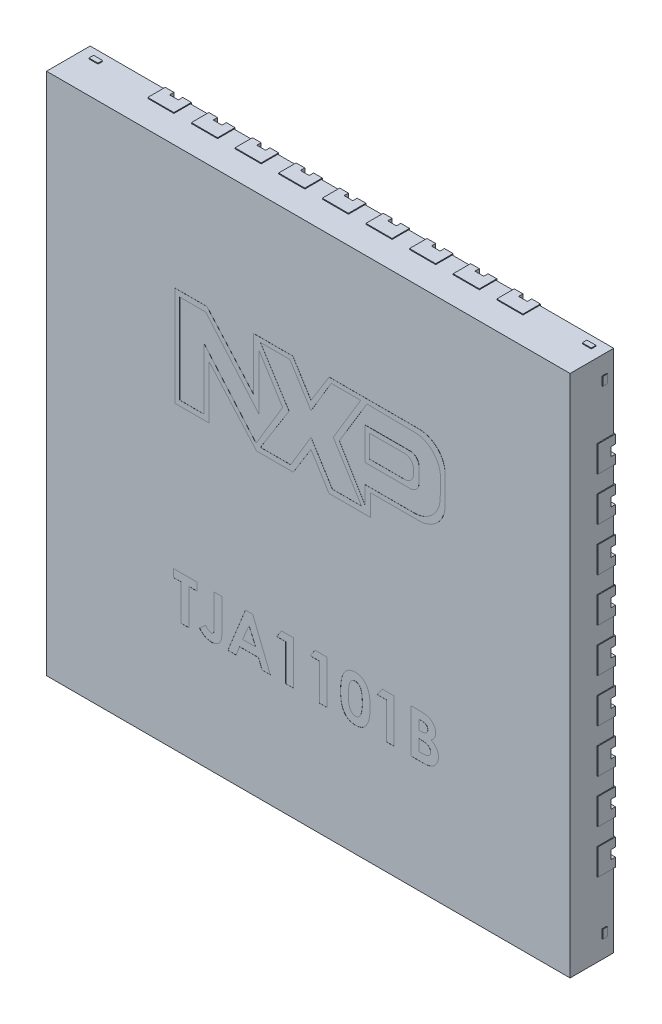
from build123d import *

# Parameters (mm, degrees)
SKETCH1_W           = 6
SKETCH1_H           = 6
BOSS_EXTRUDE1_DEPTH = 0.5
CUT_EXTRUDE2_DEPTH  = 0.001
BOSS_EXTRUDE2_DEPTH = 0.001
CUT_EXTRUDE3_DEPTH  = 0.001
BOSS_EXTRUDE3_DEPTH = 0.002
BOSS_EXTRUDE4_DEPTH = 0.01
SKETCH11_W          = 9.358912621
SKETCH11_H          = 9.422291262
SKETCH11_W_2        = 6
SKETCH11_H_2        = 6
CUT_EXTRUDE4_DEPTH  = 10.01
SKETCH14_W          = 0.3
SKETCH14_H          = 0.2
BOSS_EXTRUDE5_DEPTH = 0.01
SKETCH15_W          = 0.2
SKETCH15_H          = 0.3
BOSS_EXTRUDE6_DEPTH = 0.01
CUT_EXTRUDE6_DEPTH  = 0.05
SKETCH17_W          = 0.102885944
SKETCH17_H          = 0.053280221
BOSS_EXTRUDE7_DEPTH = 0.01
SKETCH18_W          = 0.053280221
SKETCH18_H          = 0.097122664
BOSS_EXTRUDE8_DEPTH = 0.01


with BuildPart() as part:
    # Sketch1 → Boss-Extrude1 (new body)
    with BuildSketch(Plane.XY):
        Rectangle(SKETCH1_W, SKETCH1_H)
    extrude(amount=BOSS_EXTRUDE1_DEPTH)

    # Sketch4 → Cut-Extrude2 (cut)
    with BuildSketch(Plane(origin=(0, 0, 0), x_dir=(-1, 0, 0), z_dir=(0, 0, -1))):
        with BuildLine():
            Line((-1.632420425, 1.980816377), (1.632420425, 1.980816377))
            ThreePointArc((1.632420425, 1.980816377), (1.809197121, 1.907593072), (1.882420425, 1.730816377))
            Line((1.882420425, 1.730816377), (1.882420425, 1.473194929))
            ThreePointArc((1.882420425, 1.473194929), (1.863122952, 1.414143238), (1.81267838, 1.377882515))
            ThreePointArc((1.81267838, 1.377882515), (1.651928824, 1.158195408), (1.81267838, 0.9385083))
            ThreePointArc((1.81267838, 0.9385083), (1.863122952, 0.902247578), (1.882420425, 0.843195886))
            Line((1.882420425, 0.843195886), (1.882420425, -1.730816377))
            ThreePointArc((1.882420425, -1.730816377), (1.809197121, -1.907593072), (1.632420425, -1.980816377))
            Line((1.632420425, -1.980816377), (-1.632420425, -1.980816377))
            ThreePointArc((-1.632420425, -1.980816377), (-1.809197121, -1.907593072), (-1.882420425, -1.730816377))
            Line((-1.882420425, -1.730816377), (-1.882420425, 1.730816377))
            ThreePointArc((-1.882420425, 1.730816377), (-1.809197121, 1.907593072), (-1.632420425, 1.980816377))
        make_face()
    extrude(amount=-CUT_EXTRUDE2_DEPTH, mode=Mode.SUBTRACT)

    # Sketch6 → Boss-Extrude2 (add)
    # profile 1 of 2: a face of its own
    with BuildSketch(Plane.XY.offset(0.5)):
        with BuildLine():
            Line((-1.524331059, 1.583977658), (-1.524331059, 0.440478152))
            Line((-1.524331059, 0.440478152), (-1.136298147, 0.440478152))
            Line((-1.136298147, 0.440478152), (-1.136298147, 1.050554927))
            Line((-1.136298147, 1.050554927), (-0.591676873, 0.434661093))
            Line((-0.591676873, 0.434661093), (-0.171145925, 0.434661093))
            Line((-0.171145925, 0.434661093), (0.031521656, 0.762795066))
            Line((0.031521656, 0.762795066), (0.238715079, 0.428764857))
            Line((0.238715079, 0.428764857), (0.713235707, 0.428764857))
            Line((0.713235707, 0.428764857), (0.713235707, 0.673240517))
            Line((0.713235707, 0.673240517), (1.269035348, 0.673240517))
            ThreePointArc((1.269035348, 0.673240517), (1.481167382, 0.761108482), (1.569035348, 0.973240517))
            Line((1.569035348, 0.973240517), (1.569035348, 1.283977658))
            ThreePointArc((1.569035348, 1.283977658), (1.481167382, 1.496109692), (1.269035348, 1.583977658))
            Line((1.269035348, 1.583977658), (0.238715079, 1.583977658))
            Line((0.238715079, 1.583977658), (0.031521656, 1.248516007))
            Line((0.031521656, 1.248516007), (-0.176559667, 1.583977658))
            Line((-0.176559667, 1.583977658), (-0.629445525, 1.583977658))
            Line((-0.629445525, 1.583977658), (-0.629445525, 0.983049728))
            Line((-0.629445525, 0.983049728), (-1.160832782, 1.583977658))
            Line((-1.160832782, 1.583977658), (-1.524331059, 1.583977658))
        make_face()
        Polygon((-1.191692066, 0.499212552), (-1.473221184, 0.499212552), (-1.473221184, 1.52242214), (-1.174219018, 1.52242214), (-0.565232491, 0.814958214), (-0.565232491, 1.450908946), (-0.293508609, 1.015517032), (-0.5980778, 0.508673746), (-1.191692066, 1.198279608), align=None, mode=Mode.SUBTRACT)
        Polygon((-0.219585326, 1.015517032), (-0.548394463, 1.534285532), (-0.210251019, 1.534285532), (0.031521656, 1.147283042), (0.263532133, 1.534285532), (0.601065005, 1.534285532), (0.286818461, 1.010110088), (0.611783857, 0.489942052), (0.27646434, 0.489942052), (0.031521656, 0.882018736), (-0.201518531, 0.493298651), (-0.548394463, 0.493298651), align=None, mode=Mode.SUBTRACT)
        with BuildLine():
            Line((0.355798497, 1.010110088), (0.673285753, 1.534285532))
            Line((0.673285753, 1.534285532), (1.219758388, 1.526626401))
            ThreePointArc((1.219758388, 1.526626401), (1.430638191, 1.435794203), (1.515524666, 1.222451602))
            Line((1.515524666, 1.222451602), (1.51266548, 1.018451014))
            ThreePointArc((1.51266548, 1.018451014), (1.4233353, 0.809041981), (1.212694941, 0.722655275))
            Line((1.212694941, 0.722655275), (0.650882959, 0.722655275))
            Line((0.650882959, 0.722655275), (0.650882959, 0.520703779))
            Line((0.650882959, 0.520703779), (0.355798497, 1.010110088))
        make_face(mode=Mode.SUBTRACT)
    # profile 2 of 2: a face of its own
    with BuildSketch(Plane.XY.offset(0.5)):
        with BuildLine():
            Line((1.106758821, 1.259896567), (0.7044404, 1.259896567))
            Line((0.7044404, 1.259896567), (0.7044404, 1.002206135))
            Line((0.7044404, 1.002206135), (1.106758821, 1.002206135))
            ThreePointArc((1.106758821, 1.002206135), (1.177469499, 1.031495457), (1.206758821, 1.102206135))
            Line((1.206758821, 1.102206135), (1.206758821, 1.159896567))
            ThreePointArc((1.206758821, 1.159896567), (1.177469499, 1.230607245), (1.106758821, 1.259896567))
        make_face()
    extrude(amount=BOSS_EXTRUDE2_DEPTH)

    # Sketch8 → Cut-Extrude3 (cut)
    # profile 1 of 8: a face of its own
    with BuildSketch(Plane.XY.offset(0.5)):
        Polygon((-1.547474669, -1.208507685), (-1.2782439, -1.208507685), (-1.2782439, -1.298251275), (-1.36798749, -1.298251275), (-1.36798749, -1.708507685), (-1.45773108, -1.708507685), (-1.45773108, -1.298251275), (-1.547474669, -1.298251275), align=None)
    # profile 2 of 8: a face of its own
    with BuildSketch(Plane.XY.offset(0.5)):
        with BuildLine():
            Line((-1.079525951, -1.208507685), (-0.989782362, -1.208507685))
            Line((-0.989782362, -1.208507685), (-0.989782362, -1.540438775))
            add(Edge.make_bspline(
                [(-0.989782362, -1.540438775), (-0.989815264, -1.546782875), (-0.989878661, -1.559006705), (-0.990513378, -1.576604507), (-0.991371626, -1.592739066), (-0.992607587, -1.607384527), (-0.994443327, -1.620540184), (-0.996520827, -1.632238858), (-0.998812886, -1.642528219), (-1.002684737, -1.654043614), (-1.008695672, -1.666795603), (-1.017766346, -1.680569565), (-1.029062238, -1.69253679), (-1.042071375, -1.702931708), (-1.056903367, -1.711162517), (-1.073216522, -1.717111768), (-1.090958689, -1.720665892), (-1.10324737, -1.721103105), (-1.109574028, -1.721328198)],
                knots=[0, 0, 0, 0, 1.22248561, 2.355488409, 3.392943897, 4.335991845, 5.186735882, 5.951517034, 6.625683685, 7.215700098, 8.28923535, 9.333114649, 10.380102123, 11.447198135, 12.530158036, 13.633358744, 14.781567393, 16, 16, 16, 16], degree=3))
            add(Edge.make_bspline(
                [(-1.109574028, -1.721328198), (-1.11616583, -1.721124123), (-1.129167438, -1.720721608), (-1.148235635, -1.717293216), (-1.166562556, -1.711796471), (-1.184053387, -1.703848837), (-1.200947758, -1.693893352), (-1.216939051, -1.681544543), (-1.232361143, -1.667185398), (-1.241503454, -1.656166552), (-1.246192618, -1.650514896)],
                knots=[0, 0, 0, 0, 0.990984786, 1.954608977, 2.90473533, 3.862451285, 4.837525908, 5.848096122, 6.896271184, 8, 8, 8, 8], degree=3))
            Line((-1.246192618, -1.650514896), (-1.178283964, -1.587714416))
            add(Edge.make_bspline(
                [(-1.178283964, -1.587714416), (-1.174728344, -1.591734818), (-1.168074822, -1.599258072), (-1.158048161, -1.609068581), (-1.149003572, -1.616950192), (-1.140477519, -1.622635268), (-1.132431687, -1.626642613), (-1.124692964, -1.629529216), (-1.117020125, -1.631163197), (-1.111951213, -1.631446264), (-1.109473868, -1.631584608)],
                knots=[0, 0, 0, 0, 1.529509877, 2.862124173, 3.996688592, 4.944357383, 5.774364335, 6.554177287, 7.293378699, 8, 8, 8, 8], degree=3))
            add(Edge.make_bspline(
                [(-1.109473868, -1.631584608), (-1.107076074, -1.631459567), (-1.102465905, -1.631219154), (-1.096126745, -1.62854666), (-1.090782426, -1.624350731), (-1.087264041, -1.619526967), (-1.085021899, -1.614595782), (-1.083620966, -1.609829033), (-1.082291479, -1.604114993), (-1.081226323, -1.597456526), (-1.08042149, -1.589766781), (-1.080020338, -1.581139112), (-1.079532487, -1.571526895), (-1.079528207, -1.564811927), (-1.079525951, -1.561272108)],
                knots=[0, 0, 0, 0, 1.003927327, 1.930222208, 2.840933547, 3.835773585, 4.407906147, 5.114514582, 5.922289074, 6.876303333, 7.950072246, 9.174518422, 10.510537432, 12, 12, 12, 12], degree=3))
            Line((-1.079525951, -1.561272108), (-1.079525951, -1.208507685))
        make_face()
    # profile 3 of 8: a face of its own
    with BuildSketch(Plane.XY.offset(0.5)):
        Polygon((-0.720451432, -1.208507685), (-0.637218259, -1.208507685), (-0.435295182, -1.708507685), (-0.531148548, -1.708507685), (-0.570010727, -1.605943582), (-0.787859285, -1.605943582), (-0.826721464, -1.708507685), (-0.922474669, -1.708507685), align=None)
        Polygon((-0.678884926, -1.342622268), (-0.753804798, -1.516199992), (-0.603965054, -1.516199992), align=None, mode=Mode.SUBTRACT)
    # profile 4 of 8: a face of its own
    with BuildSketch(Plane.XY.offset(0.5)):
        Polygon((-0.307991496, -1.208507685), (-0.169269541, -1.208507685), (-0.169269541, -1.708507685), (-0.259013131, -1.708507685), (-0.259013131, -1.291841018), (-0.361577233, -1.291841018), align=None)
    # profile 5 of 8: a face of its own
    with BuildSketch(Plane.XY.offset(0.5)):
        Polygon((0.076623888, -1.208507685), (0.215345843, -1.208507685), (0.215345843, -1.708507685), (0.125602254, -1.708507685), (0.125602254, -1.291841018), (0.023038151, -1.291841018), align=None)
    # profile 6 of 8: a face of its own
    with BuildSketch(Plane.XY.offset(0.5)):
        with BuildLine():
            add(Edge.make_bspline(
                [(0.537561388, -1.195687172), (0.541905351, -1.195751659), (0.550446741, -1.195878459), (0.563026601, -1.197251799), (0.575144485, -1.199326533), (0.586847798, -1.202220063), (0.5980523, -1.206049548), (0.608839539, -1.210633375), (0.619081115, -1.216211977), (0.628907642, -1.222513294), (0.638315334, -1.229647278), (0.647078084, -1.237780388), (0.655355918, -1.246725481), (0.662969653, -1.25661779), (0.670087895, -1.267367335), (0.676687257, -1.278975821), (0.682717217, -1.291500062), (0.688245358, -1.30496266), (0.693188639, -1.319565414), (0.697352359, -1.335475822), (0.700923446, -1.35269752), (0.703937694, -1.371273374), (0.706215979, -1.391228076), (0.707751589, -1.412548368), (0.708805397, -1.43519315), (0.708891402, -1.450727284), (0.708935587, -1.458708005)],
                knots=[0, 0, 0, 0, 0.879237366, 1.728815576, 2.559023295, 3.367336655, 4.166867292, 4.954216142, 5.737608147, 6.525189134, 7.316157332, 8.124696809, 8.942788509, 9.781158001, 10.649253743, 11.551476218, 12.482711956, 13.461909668, 14.496590415, 15.601789533, 16.789733467, 18.056700938, 19.410929216, 20.8549011, 22.384193279, 24, 24, 24, 24], degree=3))
            add(Edge.make_bspline(
                [(0.708935587, -1.458708005), (0.708887835, -1.466788575), (0.708795053, -1.482488976), (0.707795396, -1.505340878), (0.70607394, -1.526815969), (0.703855203, -1.546912027), (0.70081614, -1.565618439), (0.697256974, -1.582983644), (0.693027532, -1.599001345), (0.68792142, -1.613635453), (0.682426741, -1.627121694), (0.676380286, -1.639621516), (0.669887444, -1.651168775), (0.663097141, -1.661937677), (0.655637108, -1.67161076), (0.647870446, -1.68051696), (0.63945898, -1.688317029), (0.630756865, -1.695412945), (0.621445308, -1.701545242), (0.611620337, -1.706908447), (0.60110679, -1.711258643), (0.590096309, -1.715042212), (0.578401221, -1.717758406), (0.566207357, -1.719913616), (0.553377052, -1.721104718), (0.544641663, -1.721252482), (0.540165555, -1.721328198)],
                knots=[0, 0, 0, 0, 1.643780988, 3.193836972, 4.651895693, 6.025988579, 7.305620092, 8.505800249, 9.631074763, 10.672816429, 11.65661981, 12.592235626, 13.49536222, 14.350718032, 15.179365177, 15.97804903, 16.751647189, 17.51006938, 18.259804725, 19.016521909, 19.783502495, 20.571750527, 21.382245291, 22.22305063, 23.089471752, 24, 24, 24, 24], degree=3))
            add(Edge.make_bspline(
                [(0.540165555, -1.721328198), (0.535689567, -1.721251021), (0.526921174, -1.721099834), (0.514056174, -1.719922473), (0.501797689, -1.717749675), (0.490010073, -1.715021359), (0.478775367, -1.711267015), (0.4680397, -1.706786664), (0.457885621, -1.701456922), (0.448285013, -1.695310338), (0.439270658, -1.688261898), (0.43070247, -1.680386994), (0.422599405, -1.671705585), (0.415084729, -1.662120433), (0.408035373, -1.651759479), (0.401524853, -1.640504408), (0.395557079, -1.628371605), (0.389945379, -1.615344159), (0.385069523, -1.601141603), (0.380730237, -1.585637112), (0.377175608, -1.568701442), (0.374316737, -1.550340034), (0.372034217, -1.530591787), (0.370336284, -1.50944717), (0.369331074, -1.486896333), (0.369239266, -1.47139602), (0.369191997, -1.463415537)],
                knots=[0, 0, 0, 0, 0.917216111, 1.796812873, 2.643793957, 3.46689424, 4.273913431, 5.068098542, 5.848489301, 6.620921603, 7.401012384, 8.190319798, 9.003608147, 9.831726257, 10.68377682, 11.569763213, 12.493818149, 13.453288342, 14.474581811, 15.568529029, 16.750744269, 18.018426408, 19.375425659, 20.823733699, 22.36466933, 24, 24, 24, 24], degree=3))
            add(Edge.make_bspline(
                [(0.369191997, -1.463415537), (0.36927762, -1.452327285), (0.36944283, -1.43093236), (0.37153649, -1.400022913), (0.374609452, -1.371452484), (0.379122905, -1.345268864), (0.384703727, -1.321375076), (0.391850261, -1.29992852), (0.39998607, -1.280632435), (0.406918824, -1.269201318), (0.410257702, -1.263695986)],
                knots=[0, 0, 0, 0, 1.288568992, 2.486310467, 3.599230591, 4.627010532, 5.572937695, 6.447898582, 7.252493626, 8, 8, 8, 8], degree=3))
            add(Edge.make_bspline(
                [(0.410257702, -1.263695986), (0.414139991, -1.25828755), (0.421730631, -1.247712992), (0.435003077, -1.233830574), (0.449262592, -1.221957651), (0.464802058, -1.212362916), (0.481375712, -1.204796508), (0.499125849, -1.199452439), (0.517986918, -1.196338735), (0.530939129, -1.195907603), (0.537561388, -1.195687172)],
                knots=[0, 0, 0, 0, 1.058512271, 2.069600068, 3.047294572, 4.004278952, 4.967380941, 5.939006123, 6.946246673, 8, 8, 8, 8], degree=3))
        make_face()
        with BuildLine():
            add(Edge.make_bspline(
                [(0.539764914, -1.285430762), (0.535837936, -1.285616893), (0.528138975, -1.285981808), (0.516967415, -1.289079425), (0.506433332, -1.293863863), (0.498420337, -1.299621184), (0.492422689, -1.305140268), (0.48823209, -1.310134859), (0.484190917, -1.315708463), (0.48062155, -1.322112587), (0.477251136, -1.329117124), (0.473957225, -1.336753871), (0.471257083, -1.345210402), (0.468604265, -1.354342701), (0.466280149, -1.364403253), (0.46433305, -1.375474291), (0.462593487, -1.387627811), (0.461380122, -1.400871774), (0.460248901, -1.415192324), (0.459437988, -1.43062136), (0.459098966, -1.447154721), (0.458991201, -1.458541002), (0.458935587, -1.46441714)],
                knots=[0, 0, 0, 0, 1.076674018, 2.110852608, 3.161083442, 4.239746716, 4.804137807, 5.395870207, 6.026861976, 6.692161227, 7.405688833, 8.16177676, 8.973626916, 9.841385931, 10.773283133, 11.807421078, 12.927755683, 14.143907515, 15.458935494, 16.872852025, 18.386167141, 20, 20, 20, 20], degree=3))
            add(Edge.make_bspline(
                [(0.458935587, -1.46441714), (0.459027122, -1.472029961), (0.459202646, -1.48662811), (0.46012196, -1.507620756), (0.461964649, -1.526725754), (0.464256582, -1.544072586), (0.467475695, -1.559548754), (0.471179494, -1.573300675), (0.475753356, -1.585153046), (0.481039334, -1.59527728), (0.486893794, -1.603889945), (0.493249067, -1.611210748), (0.49988878, -1.617550219), (0.507020179, -1.622699693), (0.514626252, -1.626646012), (0.522643501, -1.629484551), (0.531077021, -1.631222139), (0.536852209, -1.631463086), (0.539764914, -1.631584608)],
                knots=[0, 0, 0, 0, 1.771748488, 3.397459088, 4.888034009, 6.237357457, 7.467047327, 8.564189669, 9.548206622, 10.417051504, 11.216568818, 11.965764335, 12.669334354, 13.348544111, 14.005342236, 14.656555988, 15.322436492, 16, 16, 16, 16], degree=3))
            add(Edge.make_bspline(
                [(0.539764914, -1.631584608), (0.542577664, -1.631501454), (0.54808468, -1.631338649), (0.556115142, -1.629667475), (0.563709318, -1.62695051), (0.570844278, -1.623107171), (0.577545543, -1.618219778), (0.583780361, -1.612266854), (0.589501712, -1.605189061), (0.592834996, -1.599936292), (0.594552574, -1.59722964)],
                knots=[0, 0, 0, 0, 0.992283464, 1.942767638, 2.88273346, 3.832339453, 4.79467288, 5.803907806, 6.868395428, 8, 8, 8, 8], degree=3))
            add(Edge.make_bspline(
                [(0.594552574, -1.59722964), (0.596574733, -1.593531086), (0.600815037, -1.585775519), (0.605721923, -1.572688289), (0.609852267, -1.557928057), (0.613407193, -1.541448887), (0.615838546, -1.523185783), (0.617932424, -1.503254554), (0.618942353, -1.481554834), (0.619106624, -1.466521189), (0.619191997, -1.458708005)],
                knots=[0, 0, 0, 0, 0.710965849, 1.490837728, 2.352621235, 3.297892224, 4.334225155, 5.461620853, 6.680770821, 8, 8, 8, 8], degree=3))
            add(Edge.make_bspline(
                [(0.619191997, -1.458708005), (0.619159019, -1.450826999), (0.619095542, -1.435657408), (0.617930924, -1.413879676), (0.616309105, -1.393989332), (0.61393685, -1.376030783), (0.610884514, -1.359960433), (0.607122499, -1.345779334), (0.602687362, -1.333459537), (0.597427818, -1.323013327), (0.591602547, -1.314135481), (0.585418844, -1.306518978), (0.578850561, -1.3000162), (0.571908684, -1.294602676), (0.564432539, -1.290466337), (0.556564932, -1.28754574), (0.548289732, -1.285778876), (0.542644875, -1.285548366), (0.539764914, -1.285430762)],
                knots=[0, 0, 0, 0, 1.793836731, 3.452829483, 4.963243077, 6.335886805, 7.574563692, 8.684454726, 9.672768357, 10.54971625, 11.340229787, 12.085688095, 12.778991901, 13.440269426, 14.083255152, 14.715733572, 15.344777694, 16, 16, 16, 16], degree=3))
        make_face(mode=Mode.SUBTRACT)
    # profile 7 of 8: a face of its own
    with BuildSketch(Plane.XY.offset(0.5)):
        Polygon((0.845854658, -1.208507685), (0.984576613, -1.208507685), (0.984576613, -1.708507685), (0.894833023, -1.708507685), (0.894833023, -1.291841018), (0.79226892, -1.291841018), align=None)
    # profile 8 of 8: a face of its own
    with BuildSketch(Plane.XY.offset(0.5)):
        with BuildLine():
            Line((1.176884305, -1.708507685), (1.176884305, -1.208507685))
            Line((1.176884305, -1.208507685), (1.25701251, -1.208507685))
            add(Edge.make_bspline(
                [(1.25701251, -1.208507685), (1.262621986, -1.208507045), (1.273476214, -1.208505806), (1.289136033, -1.209055727), (1.303659193, -1.209767112), (1.316999475, -1.210562987), (1.329179585, -1.211934437), (1.340181002, -1.213379796), (1.350025706, -1.21512281), (1.356112152, -1.216686348), (1.358975651, -1.217421948)],
                knots=[0, 0, 0, 0, 1.311965854, 2.538629056, 3.664479157, 4.713267157, 5.663616078, 6.530575999, 7.308677837, 8, 8, 8, 8], degree=3))
            add(Edge.make_bspline(
                [(1.358975651, -1.217421948), (1.362735717, -1.218459524), (1.370114172, -1.220495583), (1.380682475, -1.224607492), (1.390707985, -1.229178169), (1.40017846, -1.234392458), (1.409035749, -1.240313308), (1.41724619, -1.24698771), (1.424986862, -1.254147753), (1.431982913, -1.261992986), (1.438306189, -1.270282927), (1.443799983, -1.279015405), (1.448573386, -1.288056895), (1.452393358, -1.297521177), (1.455271636, -1.307364666), (1.457376796, -1.317545329), (1.458741225, -1.32809538), (1.458870145, -1.335272924), (1.458935587, -1.338916339)],
                knots=[0, 0, 0, 0, 1.099996261, 2.158545794, 3.195537121, 4.207578794, 5.205712374, 6.197378256, 7.190519799, 8.17788031, 9.159561366, 10.129234751, 11.085776129, 12.040971148, 13.00380137, 13.975669004, 14.972423361, 16, 16, 16, 16], degree=3))
            add(Edge.make_bspline(
                [(1.458935587, -1.338916339), (1.458764476, -1.34359717), (1.458427666, -1.352810811), (1.456276096, -1.366343983), (1.452241569, -1.379134776), (1.446962488, -1.391418919), (1.439784588, -1.403150592), (1.430670044, -1.414324218), (1.419766481, -1.425283848), (1.411402846, -1.431853407), (1.407052574, -1.435270505)],
                knots=[0, 0, 0, 0, 0.986156485, 1.941127874, 2.875419072, 3.804401753, 4.751181392, 5.761612777, 6.835722519, 8, 8, 8, 8], degree=3))
            add(Edge.make_bspline(
                [(1.407052574, -1.435270505), (1.410577825, -1.437070115), (1.417489868, -1.440598653), (1.427302937, -1.446398516), (1.436388768, -1.452567405), (1.444788099, -1.458981201), (1.452324745, -1.465911793), (1.459309905, -1.472959832), (1.465398968, -1.480529139), (1.470843992, -1.488349932), (1.475576719, -1.496535456), (1.479698402, -1.505071887), (1.483179839, -1.513988387), (1.486128011, -1.52323958), (1.488326758, -1.532857284), (1.489760388, -1.54284494), (1.490858064, -1.553168484), (1.490943453, -1.560200625), (1.490986869, -1.563776114)],
                knots=[0, 0, 0, 0, 1.164658916, 2.283573913, 3.35186032, 4.395461096, 5.390182219, 6.362969632, 7.312859996, 8.245001507, 9.165155236, 10.092416118, 11.032087915, 11.979892451, 12.947605196, 13.931445124, 14.948243989, 16, 16, 16, 16], degree=3))
            add(Edge.make_bspline(
                [(1.490986869, -1.563776114), (1.490705128, -1.570605095), (1.490149114, -1.58408206), (1.486083812, -1.60386934), (1.479035868, -1.622629476), (1.469571933, -1.640287908), (1.457910544, -1.656333452), (1.444503291, -1.67038921), (1.429485155, -1.682287097), (1.415629108, -1.690317247), (1.403644719, -1.695706229), (1.393718274, -1.699038038), (1.383057482, -1.70212462), (1.371467063, -1.704292082), (1.359157136, -1.706275981), (1.346007678, -1.707500882), (1.332043266, -1.708330967), (1.322451904, -1.708447588), (1.317509305, -1.708507685)],
                knots=[0, 0, 0, 0, 1.284142165, 2.534249414, 3.780121997, 5.041676246, 6.291546858, 7.49970053, 8.684500223, 9.883330709, 10.50184324, 11.153274765, 11.851151195, 12.587658647, 13.369265475, 14.195992086, 15.070362669, 16, 16, 16, 16], degree=3))
            Line((1.317509305, -1.708507685), (1.176884305, -1.708507685))
        make_face()
        with BuildLine():
            Line((1.266627895, -1.298251275), (1.266627895, -1.407225634))
            Line((1.266627895, -1.407225634), (1.290466036, -1.407225634))
            add(Edge.make_bspline(
                [(1.290466036, -1.407225634), (1.293705853, -1.407197381), (1.299960125, -1.407142841), (1.308993757, -1.40644039), (1.317393576, -1.405241965), (1.325127723, -1.403569859), (1.332268245, -1.40144653), (1.338769525, -1.398891707), (1.34460298, -1.395774545), (1.351380105, -1.391131395), (1.358544014, -1.384298792), (1.364850323, -1.374427682), (1.368564697, -1.363075942), (1.368978378, -1.355069816), (1.369191997, -1.350935569)],
                knots=[0, 0, 0, 0, 1.065314748, 2.056525647, 2.977365736, 3.853934255, 4.656397591, 5.425096493, 6.14721249, 6.826394842, 8.123232004, 9.372140726, 10.643011755, 12, 12, 12, 12], degree=3))
            add(Edge.make_bspline(
                [(1.369191997, -1.350935569), (1.369021063, -1.34706316), (1.368690569, -1.339576013), (1.364950672, -1.329063392), (1.359141872, -1.319747058), (1.352283768, -1.313370789), (1.34582553, -1.309015986), (1.340295591, -1.306148533), (1.334226067, -1.303581619), (1.327499459, -1.301618893), (1.320154181, -1.300146133), (1.312225911, -1.299064568), (1.303700971, -1.298328408), (1.297812777, -1.298277537), (1.294772927, -1.298251275)],
                knots=[0, 0, 0, 0, 1.347982417, 2.606269829, 3.849316587, 5.153353503, 5.842674298, 6.568177932, 7.326619318, 8.142485038, 9.012069166, 9.942760135, 10.937925643, 12, 12, 12, 12], degree=3))
            Line((1.294772927, -1.298251275), (1.266627895, -1.298251275))
        make_face(mode=Mode.SUBTRACT)
        with BuildLine():
            Line((1.266627895, -1.490558967), (1.266627895, -1.618764095))
            Line((1.266627895, -1.618764095), (1.292469241, -1.618764095))
            add(Edge.make_bspline(
                [(1.292469241, -1.618764095), (1.297578108, -1.618734908), (1.307400542, -1.618678793), (1.321471162, -1.618000788), (1.334264873, -1.616778803), (1.345747777, -1.615253254), (1.355937462, -1.613186373), (1.364799484, -1.610558599), (1.372455375, -1.607667589), (1.378859229, -1.604096849), (1.384090811, -1.599941394), (1.388811766, -1.595694418), (1.392660938, -1.590795131), (1.395706474, -1.585453844), (1.398342381, -1.57980324), (1.399932174, -1.573622664), (1.401142586, -1.567095293), (1.401209198, -1.562580452), (1.401243279, -1.560270505)],
                knots=[0, 0, 0, 0, 1.753078804, 3.370512758, 4.83203934, 6.162291463, 7.344201807, 8.395507345, 9.331626367, 10.147333109, 10.898971645, 11.62040215, 12.321813352, 13.025280112, 13.727906689, 14.453419512, 15.208716525, 16, 16, 16, 16], degree=3))
            add(Edge.make_bspline(
                [(1.401243279, -1.560270505), (1.401168121, -1.557629045), (1.401021732, -1.552484189), (1.399826173, -1.544964435), (1.397653453, -1.537944245), (1.394916806, -1.531244104), (1.391108615, -1.5251039), (1.386582711, -1.519311145), (1.381114264, -1.514061998), (1.374964675, -1.509038973), (1.36779179, -1.504641042), (1.359592241, -1.500825057), (1.350321485, -1.497638088), (1.339950804, -1.495100621), (1.328525664, -1.492947107), (1.315962672, -1.491661222), (1.302366458, -1.490704853), (1.292938621, -1.4906087), (1.28806219, -1.490558967)],
                knots=[0, 0, 0, 0, 0.845221588, 1.646264278, 2.427170338, 3.19324141, 3.95557735, 4.731569926, 5.540061037, 6.376114724, 7.268642756, 8.224665384, 9.265483498, 10.400594375, 11.639216012, 12.983232105, 14.439614077, 16, 16, 16, 16], degree=3))
            Line((1.28806219, -1.490558967), (1.266627895, -1.490558967))
        make_face(mode=Mode.SUBTRACT)
    extrude(amount=-CUT_EXTRUDE3_DEPTH, mode=Mode.SUBTRACT)

    # Sketch10 → Boss-Extrude3 (add)
    with BuildSketch(Plane.XY.offset(0.5)):
        with BuildLine():
            Line((0.650882959, 1.315227354), (1.169035348, 1.315227354))
            ThreePointArc((1.169035348, 1.315227354), (1.239746026, 1.285938032), (1.269035348, 1.215227354))
            Line((1.269035348, 1.215227354), (1.269035348, 1.043250014))
            ThreePointArc((1.269035348, 1.043250014), (1.239746026, 0.972539336), (1.169035348, 0.943250014))
            Line((1.169035348, 0.943250014), (0.650882959, 0.943250014))
            Line((0.650882959, 0.943250014), (0.650882959, 1.315227354))
        make_face()
        with BuildLine():
            Line((1.206758821, 1.159896567), (1.206758821, 1.102206135))
            ThreePointArc((1.206758821, 1.102206135), (1.177469499, 1.031495457), (1.106758821, 1.002206135))
            Line((1.106758821, 1.002206135), (0.7044404, 1.002206135))
            Line((0.7044404, 1.002206135), (0.7044404, 1.259896567))
            Line((0.7044404, 1.259896567), (1.106758821, 1.259896567))
            ThreePointArc((1.106758821, 1.259896567), (1.177469499, 1.230607245), (1.206758821, 1.159896567))
        make_face(mode=Mode.SUBTRACT)
    extrude(amount=BOSS_EXTRUDE3_DEPTH)

    # Sketch2 → Boss-Extrude4 (add)
    with BuildSketch(Plane(origin=(0, 0, 0), x_dir=(-1, 0, 0), z_dir=(0, 0, -1))):
        with BuildLine():
            Line((-2.15, 2.65), (-2.15, 3.35))
            ThreePointArc((-2.15, 3.35), (-2, 3.5), (-1.85, 3.35))
            Line((-1.85, 3.35), (-1.85, 2.65))
            ThreePointArc((-1.85, 2.65), (-2, 2.5), (-2.15, 2.65))
        make_face()
        with BuildLine():
            Line((-1.35, 2.65), (-1.35, 3.35))
            ThreePointArc((-1.35, 3.35), (-1.5, 3.5), (-1.65, 3.35))
            Line((-1.65, 3.35), (-1.65, 2.65))
            ThreePointArc((-1.65, 2.65), (-1.5, 2.5), (-1.35, 2.65))
        make_face()
        with BuildLine():
            Line((-0.85, 2.65), (-0.85, 3.35))
            ThreePointArc((-0.85, 3.35), (-1, 3.5), (-1.15, 3.35))
            Line((-1.15, 3.35), (-1.15, 2.65))
            ThreePointArc((-1.15, 2.65), (-1, 2.5), (-0.85, 2.65))
        make_face()
        with BuildLine():
            Line((-0.35, 2.65), (-0.35, 3.35))
            ThreePointArc((-0.35, 3.35), (-0.5, 3.5), (-0.65, 3.35))
            Line((-0.65, 3.35), (-0.65, 2.65))
            ThreePointArc((-0.65, 2.65), (-0.5, 2.5), (-0.35, 2.65))
        make_face()
        with BuildLine():
            Line((0.15, 2.65), (0.15, 3.35))
            ThreePointArc((0.15, 3.35), (0, 3.5), (-0.15, 3.35))
            Line((-0.15, 3.35), (-0.15, 2.65))
            ThreePointArc((-0.15, 2.65), (0, 2.5), (0.15, 2.65))
        make_face()
        with BuildLine():
            Line((0.65, 2.65), (0.65, 3.35))
            ThreePointArc((0.65, 3.35), (0.5, 3.5), (0.35, 3.35))
            Line((0.35, 3.35), (0.35, 2.65))
            ThreePointArc((0.35, 2.65), (0.5, 2.5), (0.65, 2.65))
        make_face()
        with BuildLine():
            Line((1.15, 2.65), (1.15, 3.35))
            ThreePointArc((1.15, 3.35), (1, 3.5), (0.85, 3.35))
            Line((0.85, 3.35), (0.85, 2.65))
            ThreePointArc((0.85, 2.65), (1, 2.5), (1.15, 2.65))
        make_face()
        with BuildLine():
            Line((1.65, 2.65), (1.65, 3.35))
            ThreePointArc((1.65, 3.35), (1.5, 3.5), (1.35, 3.35))
            Line((1.35, 3.35), (1.35, 2.65))
            ThreePointArc((1.35, 2.65), (1.5, 2.5), (1.65, 2.65))
        make_face()
        with BuildLine():
            Line((2.15, 2.65), (2.15, 3.35))
            ThreePointArc((2.15, 3.35), (2, 3.5), (1.85, 3.35))
            Line((1.85, 3.35), (1.85, 2.65))
            ThreePointArc((1.85, 2.65), (2, 2.5), (2.15, 2.65))
        make_face()
        with BuildLine():
            Line((-2.15, -2.65), (-2.15, -3.35))
            ThreePointArc((-2.15, -3.35), (-2, -3.5), (-1.85, -3.35))
            Line((-1.85, -3.35), (-1.85, -2.65))
            ThreePointArc((-1.85, -2.65), (-2, -2.5), (-2.15, -2.65))
        make_face()
        with BuildLine():
            Line((-1.65, -2.65), (-1.65, -3.35))
            ThreePointArc((-1.65, -3.35), (-1.5, -3.5), (-1.35, -3.35))
            Line((-1.35, -3.35), (-1.35, -2.65))
            ThreePointArc((-1.35, -2.65), (-1.5, -2.5), (-1.65, -2.65))
        make_face()
        with BuildLine():
            Line((-1.15, -2.65), (-1.15, -3.35))
            ThreePointArc((-1.15, -3.35), (-1, -3.5), (-0.85, -3.35))
            Line((-0.85, -3.35), (-0.85, -2.65))
            ThreePointArc((-0.85, -2.65), (-1, -2.5), (-1.15, -2.65))
        make_face()
        with BuildLine():
            Line((-0.65, -2.65), (-0.65, -3.35))
            ThreePointArc((-0.65, -3.35), (-0.5, -3.5), (-0.35, -3.35))
            Line((-0.35, -3.35), (-0.35, -2.65))
            ThreePointArc((-0.35, -2.65), (-0.5, -2.5), (-0.65, -2.65))
        make_face()
        with BuildLine():
            Line((-0.15, -2.65), (-0.15, -3.35))
            ThreePointArc((-0.15, -3.35), (0, -3.5), (0.15, -3.35))
            Line((0.15, -3.35), (0.15, -2.65))
            ThreePointArc((0.15, -2.65), (0, -2.5), (-0.15, -2.65))
        make_face()
        with BuildLine():
            Line((0.35, -2.65), (0.35, -3.35))
            ThreePointArc((0.35, -3.35), (0.5, -3.5), (0.65, -3.35))
            Line((0.65, -3.35), (0.65, -2.65))
            ThreePointArc((0.65, -2.65), (0.5, -2.5), (0.35, -2.65))
        make_face()
        with BuildLine():
            Line((0.85, -2.65), (0.85, -3.35))
            ThreePointArc((0.85, -3.35), (1, -3.5), (1.15, -3.35))
            Line((1.15, -3.35), (1.15, -2.65))
            ThreePointArc((1.15, -2.65), (1, -2.5), (0.85, -2.65))
        make_face()
        with BuildLine():
            Line((1.35, -2.65), (1.35, -3.35))
            ThreePointArc((1.35, -3.35), (1.5, -3.5), (1.65, -3.35))
            Line((1.65, -3.35), (1.65, -2.65))
            ThreePointArc((1.65, -2.65), (1.5, -2.5), (1.35, -2.65))
        make_face()
        with BuildLine():
            Line((1.85, -2.65), (1.85, -3.35))
            ThreePointArc((1.85, -3.35), (2, -3.5), (2.15, -3.35))
            Line((2.15, -3.35), (2.15, -2.65))
            ThreePointArc((2.15, -2.65), (2, -2.5), (1.85, -2.65))
        make_face()
        with BuildLine():
            Line((-2.65, 2.15), (-3.35, 2.15))
            ThreePointArc((-3.35, 2.15), (-3.5, 2), (-3.35, 1.85))
            Line((-3.35, 1.85), (-2.65, 1.85))
            ThreePointArc((-2.65, 1.85), (-2.5, 2), (-2.65, 2.15))
        make_face()
        with BuildLine():
            Line((-2.65, 1.65), (-3.35, 1.65))
            ThreePointArc((-3.35, 1.65), (-3.5, 1.5), (-3.35, 1.35))
            Line((-3.35, 1.35), (-2.65, 1.35))
            ThreePointArc((-2.65, 1.35), (-2.5, 1.5), (-2.65, 1.65))
        make_face()
        with BuildLine():
            Line((-2.65, 1.15), (-3.35, 1.15))
            ThreePointArc((-3.35, 1.15), (-3.5, 1), (-3.35, 0.85))
            Line((-3.35, 0.85), (-2.65, 0.85))
            ThreePointArc((-2.65, 0.85), (-2.5, 1), (-2.65, 1.15))
        make_face()
        with BuildLine():
            Line((-2.65, 0.65), (-3.35, 0.65))
            ThreePointArc((-3.35, 0.65), (-3.5, 0.5), (-3.35, 0.35))
            Line((-3.35, 0.35), (-2.65, 0.35))
            ThreePointArc((-2.65, 0.35), (-2.5, 0.5), (-2.65, 0.65))
        make_face()
        with BuildLine():
            Line((-2.65, 0.15), (-3.35, 0.15))
            ThreePointArc((-3.35, 0.15), (-3.5, 0), (-3.35, -0.15))
            Line((-3.35, -0.15), (-2.65, -0.15))
            ThreePointArc((-2.65, -0.15), (-2.5, 0), (-2.65, 0.15))
        make_face()
        with BuildLine():
            Line((-2.65, -0.35), (-3.35, -0.35))
            ThreePointArc((-3.35, -0.35), (-3.5, -0.5), (-3.35, -0.65))
            Line((-3.35, -0.65), (-2.65, -0.65))
            ThreePointArc((-2.65, -0.65), (-2.5, -0.5), (-2.65, -0.35))
        make_face()
        with BuildLine():
            Line((-2.65, -0.85), (-3.35, -0.85))
            ThreePointArc((-3.35, -0.85), (-3.5, -1), (-3.35, -1.15))
            Line((-3.35, -1.15), (-2.65, -1.15))
            ThreePointArc((-2.65, -1.15), (-2.5, -1), (-2.65, -0.85))
        make_face()
        with BuildLine():
            Line((-2.65, -1.35), (-3.35, -1.35))
            ThreePointArc((-3.35, -1.35), (-3.5, -1.5), (-3.35, -1.65))
            Line((-3.35, -1.65), (-2.65, -1.65))
            ThreePointArc((-2.65, -1.65), (-2.5, -1.5), (-2.65, -1.35))
        make_face()
        with BuildLine():
            Line((-2.65, -1.85), (-3.35, -1.85))
            ThreePointArc((-3.35, -1.85), (-3.5, -2), (-3.35, -2.15))
            Line((-3.35, -2.15), (-2.65, -2.15))
            ThreePointArc((-2.65, -2.15), (-2.5, -2), (-2.65, -1.85))
        make_face()
        with BuildLine():
            Line((2.65, 2.15), (3.35, 2.15))
            ThreePointArc((3.35, 2.15), (3.5, 2), (3.35, 1.85))
            Line((3.35, 1.85), (2.65, 1.85))
            ThreePointArc((2.65, 1.85), (2.5, 2), (2.65, 2.15))
        make_face()
        with BuildLine():
            Line((2.65, 1.65), (3.35, 1.65))
            ThreePointArc((3.35, 1.65), (3.5, 1.5), (3.35, 1.35))
            Line((3.35, 1.35), (2.65, 1.35))
            ThreePointArc((2.65, 1.35), (2.5, 1.5), (2.65, 1.65))
        make_face()
        with BuildLine():
            Line((2.65, 1.15), (3.35, 1.15))
            ThreePointArc((3.35, 1.15), (3.5, 1), (3.35, 0.85))
            Line((3.35, 0.85), (2.65, 0.85))
            ThreePointArc((2.65, 0.85), (2.5, 1), (2.65, 1.15))
        make_face()
        with BuildLine():
            Line((2.65, 0.65), (3.35, 0.65))
            ThreePointArc((3.35, 0.65), (3.5, 0.5), (3.35, 0.35))
            Line((3.35, 0.35), (2.65, 0.35))
            ThreePointArc((2.65, 0.35), (2.5, 0.5), (2.65, 0.65))
        make_face()
        with BuildLine():
            Line((2.65, 0.15), (3.35, 0.15))
            ThreePointArc((3.35, 0.15), (3.5, 0), (3.35, -0.15))
            Line((3.35, -0.15), (2.65, -0.15))
            ThreePointArc((2.65, -0.15), (2.5, 0), (2.65, 0.15))
        make_face()
        with BuildLine():
            Line((2.65, -0.35), (3.35, -0.35))
            ThreePointArc((3.35, -0.35), (3.5, -0.5), (3.35, -0.65))
            Line((3.35, -0.65), (2.65, -0.65))
            ThreePointArc((2.65, -0.65), (2.5, -0.5), (2.65, -0.35))
        make_face()
        with BuildLine():
            Line((2.65, -0.85), (3.35, -0.85))
            ThreePointArc((3.35, -0.85), (3.5, -1), (3.35, -1.15))
            Line((3.35, -1.15), (2.65, -1.15))
            ThreePointArc((2.65, -1.15), (2.5, -1), (2.65, -0.85))
        make_face()
        with BuildLine():
            Line((2.65, -1.35), (3.35, -1.35))
            ThreePointArc((3.35, -1.35), (3.5, -1.5), (3.35, -1.65))
            Line((3.35, -1.65), (2.65, -1.65))
            ThreePointArc((2.65, -1.65), (2.5, -1.5), (2.65, -1.35))
        make_face()
        with BuildLine():
            Line((2.65, -1.85), (3.35, -1.85))
            ThreePointArc((3.35, -1.85), (3.5, -2), (3.35, -2.15))
            Line((3.35, -2.15), (2.65, -2.15))
            ThreePointArc((2.65, -2.15), (2.5, -2), (2.65, -1.85))
        make_face()
    extrude(amount=BOSS_EXTRUDE4_DEPTH)

    # Sketch11 → Cut-Extrude4 (cut)
    with BuildSketch(Plane.XY.offset(0.5)):
        with Locations((-0.010563106, -0.401398058)):
            Rectangle(SKETCH11_W, SKETCH11_H)
        Rectangle(SKETCH11_W_2, SKETCH11_H_2, mode=Mode.SUBTRACT)
    extrude(amount=-CUT_EXTRUDE4_DEPTH, mode=Mode.SUBTRACT)

    # Sketch14 → Boss-Extrude5 (add)
    with BuildSketch(Plane.XZ.offset(3)):
        with Locations((-2, 0.09)):
            Rectangle(SKETCH14_W, SKETCH14_H)
        with Locations((-1.5, 0.09)):
            Rectangle(SKETCH14_W, SKETCH14_H)
        with Locations((-1, 0.09)):
            Rectangle(SKETCH14_W, SKETCH14_H)
        with Locations((-0.5, 0.09)):
            Rectangle(SKETCH14_W, SKETCH14_H)
        with Locations((0, 0.09)):
            Rectangle(SKETCH14_W, SKETCH14_H)
        with Locations((0.5, 0.09)):
            Rectangle(SKETCH14_W, SKETCH14_H)
        with Locations((1, 0.09)):
            Rectangle(SKETCH14_W, SKETCH14_H)
        with Locations((1.5, 0.09)):
            Rectangle(SKETCH14_W, SKETCH14_H)
        with Locations((2, 0.09)):
            Rectangle(SKETCH14_W, SKETCH14_H)
    boss_extrude5 = extrude(amount=BOSS_EXTRUDE5_DEPTH)

    # Sketch15 → Boss-Extrude6 (add)
    with BuildSketch(Plane.ZY.offset(3)):
        with Locations((0.09, -1.500001104)):
            Rectangle(SKETCH15_W, SKETCH15_H)
        with Locations((0.09, -2)):
            Rectangle(SKETCH15_W, SKETCH15_H)
        with Locations((0.09, -1.000002207)):
            Rectangle(SKETCH15_W, SKETCH15_H)
        with Locations((0.09, -0.500003311)):
            Rectangle(SKETCH15_W, SKETCH15_H)
        with Locations((0.09, -4.415e-06)):
            Rectangle(SKETCH15_W, SKETCH15_H)
        with Locations((0.09, 0.499994482)):
            Rectangle(SKETCH15_W, SKETCH15_H)
        with Locations((0.09, 0.999993378)):
            Rectangle(SKETCH15_W, SKETCH15_H)
        with Locations((0.09, 1.499992274)):
            Rectangle(SKETCH15_W, SKETCH15_H)
        with Locations((0.09, 1.99999117)):
            Rectangle(SKETCH15_W, SKETCH15_H)
    boss_extrude6 = extrude(amount=BOSS_EXTRUDE6_DEPTH)

    # Mirror1: Boss-Extrude6 across plane
    add(boss_extrude6.mirror(Plane(origin=(0, 0, 0), x_dir=(0, 0, 1), z_dir=(1, 0, 0))))

    # Mirror2: Boss-Extrude5 across plane
    add(boss_extrude5.mirror(Plane.ZX))

    # Sketch16 → Cut-Extrude6 (cut)
    with BuildSketch(Plane(origin=(0, 0, -0.01), x_dir=(-1, 0, 0), z_dir=(0, 0, -1))):
        with BuildLine():
            Line((-1.95, 3.06), (-1.95, 2.96))
            ThreePointArc((-1.95, 2.96), (-2, 2.91), (-2.05, 2.96))
            Line((-2.05, 2.96), (-2.05, 3.06))
            ThreePointArc((-2.05, 3.06), (-2, 3.11), (-1.95, 3.06))
        make_face()
        with BuildLine():
            Line((-1.55, 3.06), (-1.55, 2.96))
            ThreePointArc((-1.55, 2.96), (-1.5, 2.91), (-1.45, 2.96))
            Line((-1.45, 2.96), (-1.45, 3.06))
            ThreePointArc((-1.45, 3.06), (-1.5, 3.11), (-1.55, 3.06))
        make_face()
        with BuildLine():
            Line((-1.05, 3.06), (-1.05, 2.96))
            ThreePointArc((-1.05, 2.96), (-1, 2.91), (-0.95, 2.96))
            Line((-0.95, 2.96), (-0.95, 3.06))
            ThreePointArc((-0.95, 3.06), (-1, 3.11), (-1.05, 3.06))
        make_face()
        with BuildLine():
            Line((-0.55, 3.06), (-0.55, 2.96))
            ThreePointArc((-0.55, 2.96), (-0.5, 2.91), (-0.45, 2.96))
            Line((-0.45, 2.96), (-0.45, 3.06))
            ThreePointArc((-0.45, 3.06), (-0.5, 3.11), (-0.55, 3.06))
        make_face()
        with BuildLine():
            Line((-0.05, 3.06), (-0.05, 2.96))
            ThreePointArc((-0.05, 2.96), (0, 2.91), (0.05, 2.96))
            Line((0.05, 2.96), (0.05, 3.06))
            ThreePointArc((0.05, 3.06), (0, 3.11), (-0.05, 3.06))
        make_face()
        with BuildLine():
            Line((0.45, 3.06), (0.45, 2.96))
            ThreePointArc((0.45, 2.96), (0.5, 2.91), (0.55, 2.96))
            Line((0.55, 2.96), (0.55, 3.06))
            ThreePointArc((0.55, 3.06), (0.5, 3.11), (0.45, 3.06))
        make_face()
        with BuildLine():
            Line((0.95, 3.06), (0.95, 2.96))
            ThreePointArc((0.95, 2.96), (1, 2.91), (1.05, 2.96))
            Line((1.05, 2.96), (1.05, 3.06))
            ThreePointArc((1.05, 3.06), (1, 3.11), (0.95, 3.06))
        make_face()
        with BuildLine():
            Line((1.45, 3.06), (1.45, 2.96))
            ThreePointArc((1.45, 2.96), (1.5, 2.91), (1.55, 2.96))
            Line((1.55, 2.96), (1.55, 3.06))
            ThreePointArc((1.55, 3.06), (1.5, 3.11), (1.45, 3.06))
        make_face()
        with BuildLine():
            Line((1.95, 3.06), (1.95, 2.96))
            ThreePointArc((1.95, 2.96), (2, 2.91), (2.05, 2.96))
            Line((2.05, 2.96), (2.05, 3.06))
            ThreePointArc((2.05, 3.06), (2, 3.11), (1.95, 3.06))
        make_face()
        with BuildLine():
            Line((-1.95, -3.06), (-1.95, -2.96))
            ThreePointArc((-1.95, -2.96), (-2, -2.91), (-2.05, -2.96))
            Line((-2.05, -2.96), (-2.05, -3.06))
            ThreePointArc((-2.05, -3.06), (-2, -3.11), (-1.95, -3.06))
        make_face()
        with BuildLine():
            Line((-1.45, -3.06), (-1.45, -2.96))
            ThreePointArc((-1.45, -2.96), (-1.5, -2.91), (-1.55, -2.96))
            Line((-1.55, -2.96), (-1.55, -3.06))
            ThreePointArc((-1.55, -3.06), (-1.5, -3.11), (-1.45, -3.06))
        make_face()
        with BuildLine():
            Line((-0.95, -3.06), (-0.95, -2.96))
            ThreePointArc((-0.95, -2.96), (-1, -2.91), (-1.05, -2.96))
            Line((-1.05, -2.96), (-1.05, -3.06))
            ThreePointArc((-1.05, -3.06), (-1, -3.11), (-0.95, -3.06))
        make_face()
        with BuildLine():
            Line((-0.45, -3.06), (-0.45, -2.96))
            ThreePointArc((-0.45, -2.96), (-0.5, -2.91), (-0.55, -2.96))
            Line((-0.55, -2.96), (-0.55, -3.06))
            ThreePointArc((-0.55, -3.06), (-0.5, -3.11), (-0.45, -3.06))
        make_face()
        with BuildLine():
            Line((0.05, -3.06), (0.05, -2.96))
            ThreePointArc((0.05, -2.96), (0, -2.91), (-0.05, -2.96))
            Line((-0.05, -2.96), (-0.05, -3.06))
            ThreePointArc((-0.05, -3.06), (0, -3.11), (0.05, -3.06))
        make_face()
        with BuildLine():
            Line((0.55, -3.06), (0.55, -2.96))
            ThreePointArc((0.55, -2.96), (0.5, -2.91), (0.45, -2.96))
            Line((0.45, -2.96), (0.45, -3.06))
            ThreePointArc((0.45, -3.06), (0.5, -3.11), (0.55, -3.06))
        make_face()
        with BuildLine():
            Line((1.05, -3.06), (1.05, -2.96))
            ThreePointArc((1.05, -2.96), (1, -2.91), (0.95, -2.96))
            Line((0.95, -2.96), (0.95, -3.06))
            ThreePointArc((0.95, -3.06), (1, -3.11), (1.05, -3.06))
        make_face()
        with BuildLine():
            Line((1.55, -3.06), (1.55, -2.96))
            ThreePointArc((1.55, -2.96), (1.5, -2.91), (1.45, -2.96))
            Line((1.45, -2.96), (1.45, -3.06))
            ThreePointArc((1.45, -3.06), (1.5, -3.11), (1.55, -3.06))
        make_face()
        with BuildLine():
            Line((2.05, -3.06), (2.05, -2.96))
            ThreePointArc((2.05, -2.96), (2, -2.91), (1.95, -2.96))
            Line((1.95, -2.96), (1.95, -3.06))
            ThreePointArc((1.95, -3.06), (2, -3.11), (2.05, -3.06))
        make_face()
        with BuildLine():
            Line((-3.06, 2.04999117), (-2.96, 2.04999117))
            ThreePointArc((-2.96, 2.04999117), (-2.91, 1.99999117), (-2.96, 1.94999117))
            Line((-2.96, 1.94999117), (-3.06, 1.94999117))
            ThreePointArc((-3.06, 1.94999117), (-3.11, 1.99999117), (-3.06, 2.04999117))
        make_face()
        with BuildLine():
            Line((-3.06, 1.44999117), (-2.96, 1.44999117))
            ThreePointArc((-2.96, 1.44999117), (-2.91, 1.49999117), (-2.96, 1.54999117))
            Line((-2.96, 1.54999117), (-3.06, 1.54999117))
            ThreePointArc((-3.06, 1.54999117), (-3.11, 1.49999117), (-3.06, 1.44999117))
        make_face()
        with BuildLine():
            Line((-3.06, 0.94999117), (-2.96, 0.94999117))
            ThreePointArc((-2.96, 0.94999117), (-2.91, 0.99999117), (-2.96, 1.04999117))
            Line((-2.96, 1.04999117), (-3.06, 1.04999117))
            ThreePointArc((-3.06, 1.04999117), (-3.11, 0.99999117), (-3.06, 0.94999117))
        make_face()
        with BuildLine():
            Line((-3.06, 0.44999117), (-2.96, 0.44999117))
            ThreePointArc((-2.96, 0.44999117), (-2.91, 0.49999117), (-2.96, 0.54999117))
            Line((-2.96, 0.54999117), (-3.06, 0.54999117))
            ThreePointArc((-3.06, 0.54999117), (-3.11, 0.49999117), (-3.06, 0.44999117))
        make_face()
        with BuildLine():
            Line((-3.06, -0.05000883), (-2.96, -0.05000883))
            ThreePointArc((-2.96, -0.05000883), (-2.91, -8.83e-06), (-2.96, 0.04999117))
            Line((-2.96, 0.04999117), (-3.06, 0.04999117))
            ThreePointArc((-3.06, 0.04999117), (-3.11, -8.83e-06), (-3.06, -0.05000883))
        make_face()
        with BuildLine():
            Line((-3.06, -0.55000883), (-2.96, -0.55000883))
            ThreePointArc((-2.96, -0.55000883), (-2.91, -0.50000883), (-2.96, -0.45000883))
            Line((-2.96, -0.45000883), (-3.06, -0.45000883))
            ThreePointArc((-3.06, -0.45000883), (-3.11, -0.50000883), (-3.06, -0.55000883))
        make_face()
        with BuildLine():
            Line((-3.06, -1.05000883), (-2.96, -1.05000883))
            ThreePointArc((-2.96, -1.05000883), (-2.91, -1.00000883), (-2.96, -0.95000883))
            Line((-2.96, -0.95000883), (-3.06, -0.95000883))
            ThreePointArc((-3.06, -0.95000883), (-3.11, -1.00000883), (-3.06, -1.05000883))
        make_face()
        with BuildLine():
            Line((-3.06, -1.55000883), (-2.96, -1.55000883))
            ThreePointArc((-2.96, -1.55000883), (-2.91, -1.50000883), (-2.96, -1.45000883))
            Line((-2.96, -1.45000883), (-3.06, -1.45000883))
            ThreePointArc((-3.06, -1.45000883), (-3.11, -1.50000883), (-3.06, -1.55000883))
        make_face()
        with BuildLine():
            Line((-3.06, -2.05000883), (-2.96, -2.05000883))
            ThreePointArc((-2.96, -2.05000883), (-2.91, -2.00000883), (-2.96, -1.95000883))
            Line((-2.96, -1.95000883), (-3.06, -1.95000883))
            ThreePointArc((-3.06, -1.95000883), (-3.11, -2.00000883), (-3.06, -2.05000883))
        make_face()
        with BuildLine():
            Line((3.06, 2.04999117), (2.96, 2.04999117))
            ThreePointArc((2.96, 2.04999117), (2.91, 1.99999117), (2.96, 1.94999117))
            Line((2.96, 1.94999117), (3.06, 1.94999117))
            ThreePointArc((3.06, 1.94999117), (3.11, 1.99999117), (3.06, 2.04999117))
        make_face()
        with BuildLine():
            Line((3.06, 1.54999117), (2.96, 1.54999117))
            ThreePointArc((2.96, 1.54999117), (2.91, 1.49999117), (2.96, 1.44999117))
            Line((2.96, 1.44999117), (3.06, 1.44999117))
            ThreePointArc((3.06, 1.44999117), (3.11, 1.49999117), (3.06, 1.54999117))
        make_face()
        with BuildLine():
            Line((3.06, 1.04999117), (2.96, 1.04999117))
            ThreePointArc((2.96, 1.04999117), (2.91, 0.99999117), (2.96, 0.94999117))
            Line((2.96, 0.94999117), (3.06, 0.94999117))
            ThreePointArc((3.06, 0.94999117), (3.11, 0.99999117), (3.06, 1.04999117))
        make_face()
        with BuildLine():
            Line((3.06, 0.54999117), (2.96, 0.54999117))
            ThreePointArc((2.96, 0.54999117), (2.91, 0.49999117), (2.96, 0.44999117))
            Line((2.96, 0.44999117), (3.06, 0.44999117))
            ThreePointArc((3.06, 0.44999117), (3.11, 0.49999117), (3.06, 0.54999117))
        make_face()
        with BuildLine():
            Line((3.06, 0.04999117), (2.96, 0.04999117))
            ThreePointArc((2.96, 0.04999117), (2.91, -8.83e-06), (2.96, -0.05000883))
            Line((2.96, -0.05000883), (3.06, -0.05000883))
            ThreePointArc((3.06, -0.05000883), (3.11, -8.83e-06), (3.06, 0.04999117))
        make_face()
        with BuildLine():
            Line((3.06, -0.45000883), (2.96, -0.45000883))
            ThreePointArc((2.96, -0.45000883), (2.91, -0.50000883), (2.96, -0.55000883))
            Line((2.96, -0.55000883), (3.06, -0.55000883))
            ThreePointArc((3.06, -0.55000883), (3.11, -0.50000883), (3.06, -0.45000883))
        make_face()
        with BuildLine():
            Line((3.06, -0.95000883), (2.96, -0.95000883))
            ThreePointArc((2.96, -0.95000883), (2.91, -1.00000883), (2.96, -1.05000883))
            Line((2.96, -1.05000883), (3.06, -1.05000883))
            ThreePointArc((3.06, -1.05000883), (3.11, -1.00000883), (3.06, -0.95000883))
        make_face()
        with BuildLine():
            Line((3.06, -1.45000883), (2.96, -1.45000883))
            ThreePointArc((2.96, -1.45000883), (2.91, -1.50000883), (2.96, -1.55000883))
            Line((2.96, -1.55000883), (3.06, -1.55000883))
            ThreePointArc((3.06, -1.55000883), (3.11, -1.50000883), (3.06, -1.45000883))
        make_face()
        with BuildLine():
            Line((3.06, -1.95000883), (2.96, -1.95000883))
            ThreePointArc((2.96, -1.95000883), (2.91, -2.00000883), (2.96, -2.05000883))
            Line((2.96, -2.05000883), (3.06, -2.05000883))
            ThreePointArc((3.06, -2.05000883), (3.11, -2.00000883), (3.06, -1.95000883))
        make_face()
    extrude(amount=-CUT_EXTRUDE6_DEPTH, mode=Mode.SUBTRACT)

    # Sketch17 → Boss-Extrude7 (add)
    with BuildSketch(Plane(origin=(0, 3, 0), x_dir=(1, 0, 0), z_dir=(0, 1, 0))):
        with Locations((-2.82646638, -0.10888348)):
            Rectangle(SKETCH17_W, SKETCH17_H)
        with Locations((2.82646638, -0.10888348)):
            Rectangle(SKETCH17_W, SKETCH17_H)
    boss_extrude7 = extrude(amount=BOSS_EXTRUDE7_DEPTH)

    # Mirror3: Boss-Extrude7 across plane
    add(boss_extrude7.mirror(Plane.ZX))

    # Sketch18 → Boss-Extrude8 (add)
    with BuildSketch(Plane.ZY.offset(3)):
        with Locations((0.10888348, -2.743920985)):
            Rectangle(SKETCH18_W, SKETCH18_H)
        with Locations((0.10888348, 2.743920985)):
            Rectangle(SKETCH18_W, SKETCH18_H)
    boss_extrude8 = extrude(amount=BOSS_EXTRUDE8_DEPTH)

    # Mirror4: Boss-Extrude8 across plane
    add(boss_extrude8.mirror(Plane(origin=(0, 0, 0), x_dir=(0, 0, 1), z_dir=(1, 0, 0))))


solid = part.part
